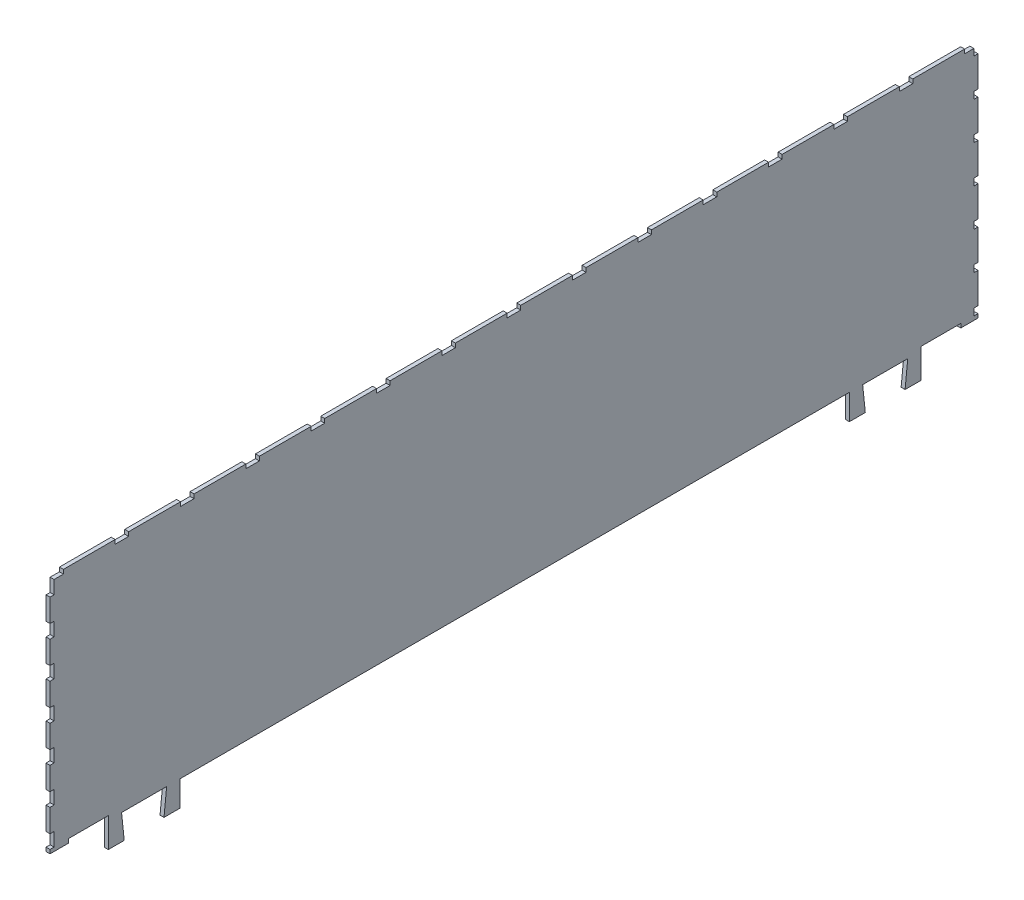
from build123d import *

# Parameters (mm, degrees)
SKETCH1_W                      = 700
SKETCH1_H                      = 180.8
BOSS_EXTRUDE1_DEPTH            = 3
SKETCH2_W                      = 54
SKETCH2_H                      = 19.2
BOSS_EXTRUDE2_DEPTH            = 3
CUT_EXTRUDE1_DEPTH             = 10
CUT_EXTRUDE2_DEPTH             = 10
SKETCH5_W                      = 30
SKETCH5_H                      = 3
CUT_EXTRUDE3_DEPTH             = 10
SKETCH9_W                      = 30
SKETCH9_H                      = 3
CUT_EXTRUDE6_DEPTH             = 10
TAB_START                      = 2.9
TAB_AND_SLOT_SLOT3_OUTLINE_W   = 3
TAB_AND_SLOT_SLOT3_OUTLINE_H   = 3.1
TAB_AND_SLOT_SLOT3_DEPTH       = 5.2
TAB_START_2                    = 31.2
TAB_AND_SLOT_SLOT3_2_OUTLINE_W = 3
TAB_AND_SLOT_SLOT3_2_OUTLINE_H = 3.1
TAB_AND_SLOT_SLOT3_2_DEPTH     = 5.2
TAB_START_3                    = 59.5
TAB_AND_SLOT_SLOT3_3_OUTLINE_W = 3
TAB_AND_SLOT_SLOT3_3_OUTLINE_H = 3.1
TAB_AND_SLOT_SLOT3_3_DEPTH     = 5.2
TAB_START_4                    = 87.8
TAB_AND_SLOT_SLOT3_4_OUTLINE_W = 3
TAB_AND_SLOT_SLOT3_4_OUTLINE_H = 3.1
TAB_AND_SLOT_SLOT3_4_DEPTH     = 5.2
TAB_START_5                    = 116.1
TAB_AND_SLOT_SLOT3_5_OUTLINE_W = 3
TAB_AND_SLOT_SLOT3_5_OUTLINE_H = 3.1
TAB_AND_SLOT_SLOT3_5_DEPTH     = 5.2
TAB_START_6                    = 144.4
TAB_AND_SLOT_SLOT3_6_OUTLINE_W = 3
TAB_AND_SLOT_SLOT3_6_OUTLINE_H = 3.1
TAB_AND_SLOT_SLOT3_6_DEPTH     = 5.2
TAB_START_7                    = 172.7
TAB_AND_SLOT_SLOT3_7_OUTLINE_W = 3
TAB_AND_SLOT_SLOT3_7_OUTLINE_H = 3.1
TAB_AND_SLOT_SLOT3_7_DEPTH     = 5.2
TAB_START_8                    = 177.7
TAB_AND_SLOT_SLOT4_OUTLINE_W   = 3
TAB_AND_SLOT_SLOT4_OUTLINE_H   = 10.1
TAB_AND_SLOT_SLOT4_OUTLINE_H_2 = 10.2
TAB_AND_SLOT_SLOT4_DEPTH       = 3.1
TAB_AND_SLOT_SLOT5_DEPTH       = 10.2
TAB_START_9                    = 30.366666667
TAB_AND_SLOT_SLOT5_2_DEPTH     = 10.2
TAB_START_10                   = 57.833333333
TAB_AND_SLOT_SLOT5_3_DEPTH     = 10.2
TAB_START_11                   = 85.3
TAB_AND_SLOT_SLOT5_4_DEPTH     = 10.2
TAB_START_12                   = 112.766666667
TAB_AND_SLOT_SLOT5_5_DEPTH     = 10.2
TAB_START_13                   = 140.233333333
TAB_AND_SLOT_SLOT5_6_DEPTH     = 10.2
TAB_START_14                   = 167.7
TAB_AND_SLOT_SLOT5_7_DEPTH     = 10


# Read off the part's stored shape, not the designer's step: Tab and Slot-Slot3, Tab and Slot-Slot4, Tab and Slot-Slot5
with BuildPart() as part:
    # Sketch1 → Boss-Extrude1 (new body)
    with BuildSketch(Plane(origin=(0, 0, 0), x_dir=(0, 0, -1), z_dir=(1, 0, 0))):
        with Locations((350, 90.4)):
            Rectangle(SKETCH1_W, SKETCH1_H)
    extrude(amount=BOSS_EXTRUDE1_DEPTH)

    # Sketch2 → Boss-Extrude2 (add)
    with BuildSketch(Plane(origin=(3, 0, 0), x_dir=(0, 0, -1), z_dir=(1, 0, 0))):
        with Locations((71, -9.6)):
            Rectangle(SKETCH2_W, SKETCH2_H)
        with Locations((630, -9.6)):
            Rectangle(SKETCH2_W, SKETCH2_H)
    extrude(amount=-BOSS_EXTRUDE2_DEPTH)

    # Sketch3 → Cut-Extrude1 (cut)
    with BuildSketch(Plane(origin=(3, 0, 0), x_dir=(0, 0, -1), z_dir=(1, 0, 0))):
        Polygon((54, 0), (88, 0), (86, -19.2), (56, -19.2), align=None)
    extrude(amount=-CUT_EXTRUDE1_DEPTH, mode=Mode.SUBTRACT)

    # Sketch4 → Cut-Extrude2 (cut)
    with BuildSketch(Plane(origin=(3, 0, 0), x_dir=(0, 0, -1), z_dir=(1, 0, 0))):
        Polygon((613, 0), (647, 0), (645, -19.2), (615, -19.2), align=None)
    extrude(amount=-CUT_EXTRUDE2_DEPTH, mode=Mode.SUBTRACT)

    # Sketch5 → Cut-Extrude3 (cut)
    with BuildSketch(Plane(origin=(3, 0, 0), x_dir=(0, 0, -1), z_dir=(1, 0, 0))):
        with Locations((672, 1.5)):
            Rectangle(SKETCH5_W, SKETCH5_H)
    extrude(amount=-CUT_EXTRUDE3_DEPTH, mode=Mode.SUBTRACT)

    # Sketch9 → Cut-Extrude6 (cut)
    with BuildSketch(Plane(origin=(3, 0, 0), x_dir=(0, 0, -1), z_dir=(1, 0, 0))):
        with Locations((29, 1.5)):
            Rectangle(SKETCH9_W, SKETCH9_H)
    extrude(amount=-CUT_EXTRUDE6_DEPTH, mode=Mode.SUBTRACT)

    # Tab and Slot-Slot3 outline → Tab and Slot-Slot3 (cut)
    with BuildSketch(Plane(origin=(0, 0, 0), x_dir=(1, 0, 0), z_dir=(0, 1, 0)).offset(TAB_START)):
        with Locations((1.5, 698.45)):
            Rectangle(TAB_AND_SLOT_SLOT3_OUTLINE_W, TAB_AND_SLOT_SLOT3_OUTLINE_H)
    extrude(amount=TAB_AND_SLOT_SLOT3_DEPTH, mode=Mode.SUBTRACT)

    # Tab and Slot-Slot3 2 outline → Tab and Slot-Slot3 2 (cut)
    with BuildSketch(Plane(origin=(0, 0, 0), x_dir=(1, 0, 0), z_dir=(0, 1, 0)).offset(TAB_START_2)):
        with Locations((1.5, 698.45)):
            Rectangle(TAB_AND_SLOT_SLOT3_2_OUTLINE_W, TAB_AND_SLOT_SLOT3_2_OUTLINE_H)
    extrude(amount=TAB_AND_SLOT_SLOT3_2_DEPTH, mode=Mode.SUBTRACT)

    # Tab and Slot-Slot3 3 outline → Tab and Slot-Slot3 3 (cut)
    with BuildSketch(Plane(origin=(0, 0, 0), x_dir=(1, 0, 0), z_dir=(0, 1, 0)).offset(TAB_START_3)):
        with Locations((1.5, 698.45)):
            Rectangle(TAB_AND_SLOT_SLOT3_3_OUTLINE_W, TAB_AND_SLOT_SLOT3_3_OUTLINE_H)
    extrude(amount=TAB_AND_SLOT_SLOT3_3_DEPTH, mode=Mode.SUBTRACT)

    # Tab and Slot-Slot3 4 outline → Tab and Slot-Slot3 4 (cut)
    with BuildSketch(Plane(origin=(0, 0, 0), x_dir=(1, 0, 0), z_dir=(0, 1, 0)).offset(TAB_START_4)):
        with Locations((1.5, 698.45)):
            Rectangle(TAB_AND_SLOT_SLOT3_4_OUTLINE_W, TAB_AND_SLOT_SLOT3_4_OUTLINE_H)
    extrude(amount=TAB_AND_SLOT_SLOT3_4_DEPTH, mode=Mode.SUBTRACT)

    # Tab and Slot-Slot3 5 outline → Tab and Slot-Slot3 5 (cut)
    with BuildSketch(Plane(origin=(0, 0, 0), x_dir=(1, 0, 0), z_dir=(0, 1, 0)).offset(TAB_START_5)):
        with Locations((1.5, 698.45)):
            Rectangle(TAB_AND_SLOT_SLOT3_5_OUTLINE_W, TAB_AND_SLOT_SLOT3_5_OUTLINE_H)
    extrude(amount=TAB_AND_SLOT_SLOT3_5_DEPTH, mode=Mode.SUBTRACT)

    # Tab and Slot-Slot3 6 outline → Tab and Slot-Slot3 6 (cut)
    with BuildSketch(Plane(origin=(0, 0, 0), x_dir=(1, 0, 0), z_dir=(0, 1, 0)).offset(TAB_START_6)):
        with Locations((1.5, 698.45)):
            Rectangle(TAB_AND_SLOT_SLOT3_6_OUTLINE_W, TAB_AND_SLOT_SLOT3_6_OUTLINE_H)
    extrude(amount=TAB_AND_SLOT_SLOT3_6_DEPTH, mode=Mode.SUBTRACT)

    # Tab and Slot-Slot3 7 outline → Tab and Slot-Slot3 7 (cut)
    with BuildSketch(Plane(origin=(0, 0, 0), x_dir=(1, 0, 0), z_dir=(0, 1, 0)).offset(TAB_START_7)):
        with Locations((1.5, 698.45)):
            Rectangle(TAB_AND_SLOT_SLOT3_7_OUTLINE_W, TAB_AND_SLOT_SLOT3_7_OUTLINE_H)
    extrude(amount=TAB_AND_SLOT_SLOT3_7_DEPTH, mode=Mode.SUBTRACT)

    # Tab and Slot-Slot4 outline → Tab and Slot-Slot4 (cut)
    with BuildSketch(Plane(origin=(0, 0, 0), x_dir=(1, 0, 0), z_dir=(0, 1, 0)).offset(TAB_START_8)):
        with Locations((1.5, 694.95)):
            Rectangle(TAB_AND_SLOT_SLOT4_OUTLINE_W, TAB_AND_SLOT_SLOT4_OUTLINE_H)
        with Locations((1.5, 645.714285714)):
            Rectangle(TAB_AND_SLOT_SLOT4_OUTLINE_W, TAB_AND_SLOT_SLOT4_OUTLINE_H_2)
        with Locations((1.5, 596.428571429)):
            Rectangle(TAB_AND_SLOT_SLOT4_OUTLINE_W, TAB_AND_SLOT_SLOT4_OUTLINE_H_2)
        with Locations((1.5, 547.142857143)):
            Rectangle(TAB_AND_SLOT_SLOT4_OUTLINE_W, TAB_AND_SLOT_SLOT4_OUTLINE_H_2)
        with Locations((1.5, 497.857142857)):
            Rectangle(TAB_AND_SLOT_SLOT4_OUTLINE_W, TAB_AND_SLOT_SLOT4_OUTLINE_H_2)
        with Locations((1.5, 448.571428571)):
            Rectangle(TAB_AND_SLOT_SLOT4_OUTLINE_W, TAB_AND_SLOT_SLOT4_OUTLINE_H_2)
        with Locations((1.5, 399.285714286)):
            Rectangle(TAB_AND_SLOT_SLOT4_OUTLINE_W, TAB_AND_SLOT_SLOT4_OUTLINE_H_2)
        with Locations((1.5, 350)):
            Rectangle(TAB_AND_SLOT_SLOT4_OUTLINE_W, TAB_AND_SLOT_SLOT4_OUTLINE_H_2)
        with Locations((1.5, 300.714285714)):
            Rectangle(TAB_AND_SLOT_SLOT4_OUTLINE_W, TAB_AND_SLOT_SLOT4_OUTLINE_H_2)
        with Locations((1.5, 251.428571429)):
            Rectangle(TAB_AND_SLOT_SLOT4_OUTLINE_W, TAB_AND_SLOT_SLOT4_OUTLINE_H_2)
        with Locations((1.5, 202.142857143)):
            Rectangle(TAB_AND_SLOT_SLOT4_OUTLINE_W, TAB_AND_SLOT_SLOT4_OUTLINE_H_2)
        with Locations((1.5, 152.857142857)):
            Rectangle(TAB_AND_SLOT_SLOT4_OUTLINE_W, TAB_AND_SLOT_SLOT4_OUTLINE_H_2)
        with Locations((1.5, 103.571428571)):
            Rectangle(TAB_AND_SLOT_SLOT4_OUTLINE_W, TAB_AND_SLOT_SLOT4_OUTLINE_H_2)
        with Locations((1.5, 54.285714286)):
            Rectangle(TAB_AND_SLOT_SLOT4_OUTLINE_W, TAB_AND_SLOT_SLOT4_OUTLINE_H_2)
        with Locations((1.5, 5.05)):
            Rectangle(TAB_AND_SLOT_SLOT4_OUTLINE_W, TAB_AND_SLOT_SLOT4_OUTLINE_H)
    extrude(amount=TAB_AND_SLOT_SLOT4_DEPTH, mode=Mode.SUBTRACT)

    # Tab and Slot-Slot5 outline → Tab and Slot-Slot5 (cut)
    with BuildSketch(Plane(origin=(0, 0, 0), x_dir=(1, 0, 0), z_dir=(0, 1, 0)).offset(TAB_START)):
        Polygon((3, 3.1), (1.28e-07, 3.1), (0, 0), (3, 0), align=None)
    extrude(amount=TAB_AND_SLOT_SLOT5_DEPTH, mode=Mode.SUBTRACT)

    # Tab and Slot-Slot5 2 outline → Tab and Slot-Slot5 2 (cut)
    with BuildSketch(Plane(origin=(0, 0, 0), x_dir=(1, 0, 0), z_dir=(0, 1, 0)).offset(TAB_START_9)):
        Polygon((3, 3.1), (1.28e-07, 3.1), (0, 0), (3, 0), align=None)
    extrude(amount=TAB_AND_SLOT_SLOT5_2_DEPTH, mode=Mode.SUBTRACT)

    # Tab and Slot-Slot5 3 outline → Tab and Slot-Slot5 3 (cut)
    with BuildSketch(Plane(origin=(0, 0, 0), x_dir=(1, 0, 0), z_dir=(0, 1, 0)).offset(TAB_START_10)):
        Polygon((3, 3.1), (1.28e-07, 3.1), (0, 0), (3, 0), align=None)
    extrude(amount=TAB_AND_SLOT_SLOT5_3_DEPTH, mode=Mode.SUBTRACT)

    # Tab and Slot-Slot5 4 outline → Tab and Slot-Slot5 4 (cut)
    with BuildSketch(Plane(origin=(0, 0, 0), x_dir=(1, 0, 0), z_dir=(0, 1, 0)).offset(TAB_START_11)):
        Polygon((3, 3.1), (1.28e-07, 3.1), (0, 0), (3, 0), align=None)
    extrude(amount=TAB_AND_SLOT_SLOT5_4_DEPTH, mode=Mode.SUBTRACT)

    # Tab and Slot-Slot5 5 outline → Tab and Slot-Slot5 5 (cut)
    with BuildSketch(Plane(origin=(0, 0, 0), x_dir=(1, 0, 0), z_dir=(0, 1, 0)).offset(TAB_START_12)):
        Polygon((3, 3.1), (1.28e-07, 3.1), (0, 0), (3, 0), align=None)
    extrude(amount=TAB_AND_SLOT_SLOT5_5_DEPTH, mode=Mode.SUBTRACT)

    # Tab and Slot-Slot5 6 outline → Tab and Slot-Slot5 6 (cut)
    with BuildSketch(Plane(origin=(0, 0, 0), x_dir=(1, 0, 0), z_dir=(0, 1, 0)).offset(TAB_START_13)):
        Polygon((3, 3.1), (1.28e-07, 3.1), (0, 0), (3, 0), align=None)
    extrude(amount=TAB_AND_SLOT_SLOT5_6_DEPTH, mode=Mode.SUBTRACT)

    # Tab and Slot-Slot5 7 outline → Tab and Slot-Slot5 7 (cut)
    with BuildSketch(Plane(origin=(0, 0, 0), x_dir=(1, 0, 0), z_dir=(0, 1, 0)).offset(TAB_START_14)):
        Polygon((3, 3.1), (1.28e-07, 3.1), (0, 0), (3, 0), align=None)
    extrude(amount=TAB_AND_SLOT_SLOT5_7_DEPTH, mode=Mode.SUBTRACT)


solid = part.part
